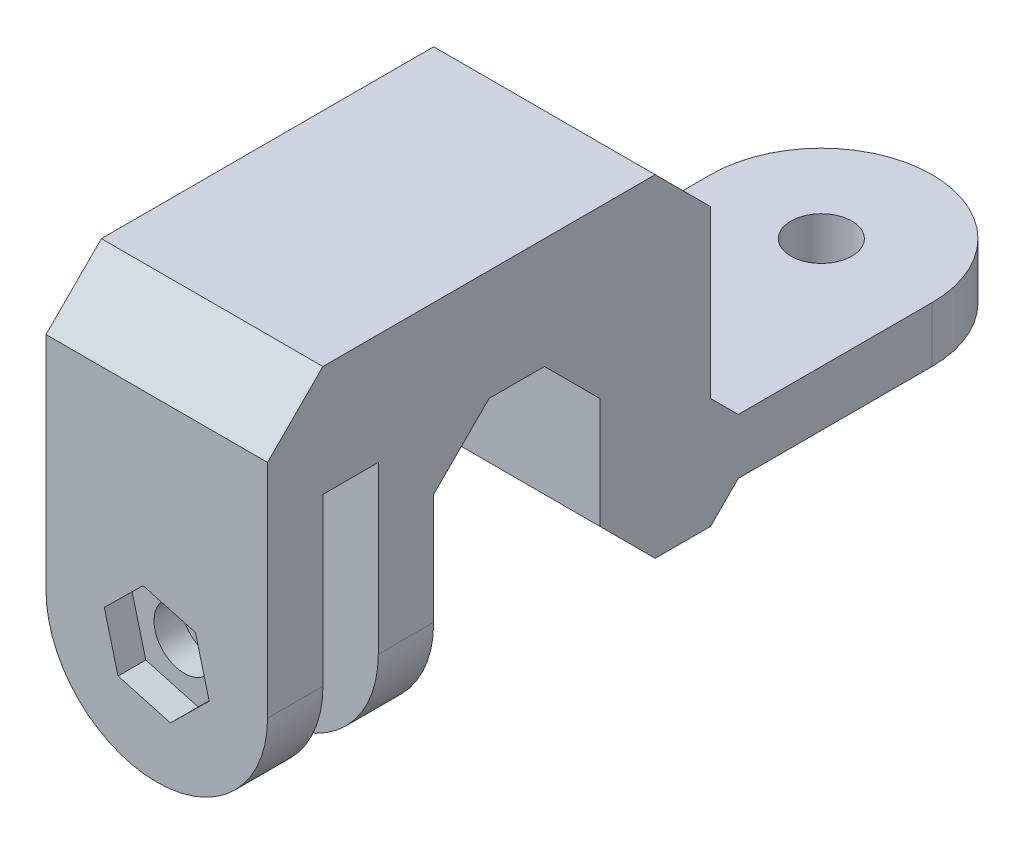
from build123d import *

# Parameters (mm, degrees)
SKETCH1_W               = 20
SKETCH1_H               = 10
BOSS_EXTRUDE1_DEPTH     = 10
SKETCH3_W               = 20
SKETCH3_H               = 5
BOSS_EXTRUDE2_DEPTH     = 20
FILLET1_R               = 10
BOSS_EXTRUDE3_DEPTH     = 20
CUT_EXTRUDE1_DEPTH      = 56.733742024
CUT_EXTRUDE1_DEPTH_BACK = 56.733742024
SKETCH5_R               = 2.75
CHAMFER1_SIZE           = 10
SKETCH6_W               = 20
SKETCH6_H               = 5
BOSS_EXTRUDE4_DEPTH     = 25
FILLET2_R               = 10
CUT_EXTRUDE2_DEPTH      = 76
CUT_EXTRUDE2_DEPTH_BACK = 15
SKETCH7_R               = 2.75
CHAMFER3_SIZE           = 5
CUT_EXTRUDE3_DEPTH      = 2.5


# Some blends are built 0.0001 mm under size
with BuildPart() as part:
    # Sketch1 → Boss-Extrude1 (new body)
    with BuildSketch(Plane.XY):
        Rectangle(SKETCH1_W, SKETCH1_H)
    extrude(amount=BOSS_EXTRUDE1_DEPTH)

    # Sketch3 → Boss-Extrude2 (add)
    with BuildSketch(Plane(origin=(0, 0, 0), x_dir=(-1, 0, 0), z_dir=(0, 0, -1))):
        Rectangle(SKETCH3_W, SKETCH3_H)
    extrude(amount=BOSS_EXTRUDE2_DEPTH)

    # Fillet1
    fillet1_edges = [part.edges().sort_by_distance(p)[0] for p in [
        (-10, 0, -20),
        (10, 0, -20),
    ]]
    fillet(fillet1_edges, radius=FILLET1_R - 0.0001)  # a hair under: the kernel refuses the full size

    # Sketch4 → Boss-Extrude3 (add)
    with BuildSketch(Plane.ZY.offset(10)):
        Polygon((20, -5), (20, 15), (50, 15), (50, 25), (10, 25), (10, -5), align=None)
    extrude(amount=-BOSS_EXTRUDE3_DEPTH)

    # Sketch5 → Cut-Extrude1 (cut, two sides: drawn at the far end of the back side and taken through both)
    with BuildSketch(Plane(origin=(0, 2.5, 0), x_dir=(1, 0, 0), z_dir=(0, 1, 0)).offset(-CUT_EXTRUDE1_DEPTH_BACK)):
        with Locations(Location((0, 10, 0), (0, 0, 270))):
            Circle(SKETCH5_R)
    extrude(amount=CUT_EXTRUDE1_DEPTH + CUT_EXTRUDE1_DEPTH_BACK, mode=Mode.SUBTRACT)

    # Chamfer1
    # the kernel refuses this chamfer: 10 mm, written as the material it takes off along each edge
    with BuildSketch(Plane(origin=(35.71682988, 5, 0), x_dir=(0, -0.9996219169112968, -0.027495876610586372), z_dir=(-1, 0, 0))) as chamfer1_piece_1_section:
        Polygon((CHAMFER1_SIZE * 0.999621916911, CHAMFER1_SIZE * 0.0274958766106), (-CHAMFER1_SIZE * 0.0274958766106, CHAMFER1_SIZE * 0.999621916911), (0, 0), align=None)
    chamfer1_piece_1 = extrude(amount=71.433659759, mode=Mode.PRIVATE)
    chamfer1_piece_1 = split(chamfer1_piece_1, bisect_by=Plane(origin=(0, -2.5, 0.578931494), z_dir=(0, -1, 0)), keep=Keep.TOP, mode=Mode.PRIVATE)
    add(chamfer1_piece_1, mode=Mode.SUBTRACT)
    with BuildSketch(Plane(origin=(35.71682988, 5, 0), x_dir=(0, -0.9996219169112968, -0.027495876610586372), z_dir=(-1, 0, 0))) as chamfer1_piece_2_section:
        Polygon((CHAMFER1_SIZE * 0.999621916911, CHAMFER1_SIZE * 0.0274958766106), (-CHAMFER1_SIZE * 0.0274958766106, CHAMFER1_SIZE * 0.999621916911), (0, 0), align=None)
    chamfer1_piece_2 = extrude(amount=71.433659759, mode=Mode.PRIVATE)
    chamfer1_piece_2 = split(chamfer1_piece_2, bisect_by=Plane(origin=(0, 2.5, 4.466280687), z_dir=(0, 1, 0)), keep=Keep.TOP, mode=Mode.PRIVATE)
    chamfer1_piece_2 = split(chamfer1_piece_2, bisect_by=Plane(origin=(0, 3.939233337, 10), z_dir=(0, 0, -1)), keep=Keep.TOP, mode=Mode.PRIVATE)
    add(chamfer1_piece_2, mode=Mode.SUBTRACT)
    with BuildSketch(Plane(origin=(-35.71682988, -5, 0), x_dir=(0, -0.027495876610586403, 0.9996219169112968), z_dir=(1, 0, 0))) as chamfer1_piece_3_section:
        Polygon((CHAMFER1_SIZE * 0.999621916911, -CHAMFER1_SIZE * 0.0274958766106), (-CHAMFER1_SIZE * 0.0274958766106, -CHAMFER1_SIZE * 0.999621916911), (0, 0), align=None)
    chamfer1_piece_3 = extrude(amount=71.433659759, mode=Mode.PRIVATE)
    chamfer1_piece_3 = split(chamfer1_piece_3, bisect_by=Plane(origin=(0, -2.5, 4.487529346), z_dir=(0, -1, 0)), keep=Keep.TOP, mode=Mode.PRIVATE)
    add(chamfer1_piece_3, mode=Mode.SUBTRACT)
    with BuildSketch(Plane(origin=(-35.71682988, -5, 0), x_dir=(0, -0.027495876610586403, 0.9996219169112968), z_dir=(1, 0, 0))) as chamfer1_piece_4_section:
        Polygon((CHAMFER1_SIZE * 0.999621916911, -CHAMFER1_SIZE * 0.0274958766106), (-CHAMFER1_SIZE * 0.0274958766106, -CHAMFER1_SIZE * 0.999621916911), (0, 0), align=None)
    chamfer1_piece_4 = extrude(amount=71.433659759, mode=Mode.PRIVATE)
    chamfer1_piece_4 = split(chamfer1_piece_4, bisect_by=Plane(origin=(0, 2.5, 0.578931494), z_dir=(0, 1, 0)), keep=Keep.TOP, mode=Mode.PRIVATE)
    add(chamfer1_piece_4, mode=Mode.SUBTRACT)

    # Sketch6 → Boss-Extrude4 (add)
    with BuildSketch(Plane.XZ.offset(-15)):
        with Locations((0, 37.5)):
            Rectangle(SKETCH6_W, SKETCH6_H)
        with Locations((0, 47.5)):
            Rectangle(SKETCH6_W, SKETCH6_H)
    extrude(amount=BOSS_EXTRUDE4_DEPTH)

    # Fillet2
    fillet2_edges = [part.edges().sort_by_distance(p)[0] for p in [
        (10, -10, 37.5),
        (-10, -10, 37.5),
        (-10, -10, 47.5),
        (10, -10, 47.5),
    ]]
    fillet(fillet2_edges, radius=FILLET2_R - 0.0001)  # a hair under: the kernel refuses the full size

    # Sketch7 → Cut-Extrude2 (cut, two sides: drawn at the far end of the back side and taken through both)
    with BuildSketch(Plane.XY.offset(50).offset(-CUT_EXTRUDE2_DEPTH_BACK)):
        Circle(SKETCH7_R)
    extrude(amount=CUT_EXTRUDE2_DEPTH + CUT_EXTRUDE2_DEPTH_BACK, mode=Mode.SUBTRACT)

    # Chamfer3
    chamfer3_edges = [part.edges().sort_by_distance(p)[0] for p in [
        (0, 15, 35),
        (0, 25, 10),
        (0, 25, 50),
        (0, 15, 20),
        (0, -5, 20),
    ]]
    chamfer(chamfer3_edges, length=CHAMFER3_SIZE)

    # Sketch8 → Cut-Extrude3 (cut)
    with BuildSketch(Plane.XY.offset(50)):
        Polygon((4.731883381, -1.301004613), (3.492644735, 3.447428909), (-1.239238646, 4.748433522), (-4.731883381, 1.301004613), (-3.492644735, -3.447428909), (1.239238646, -4.748433522), align=None)
    extrude(amount=-CUT_EXTRUDE3_DEPTH, mode=Mode.SUBTRACT)


solid = part.part
